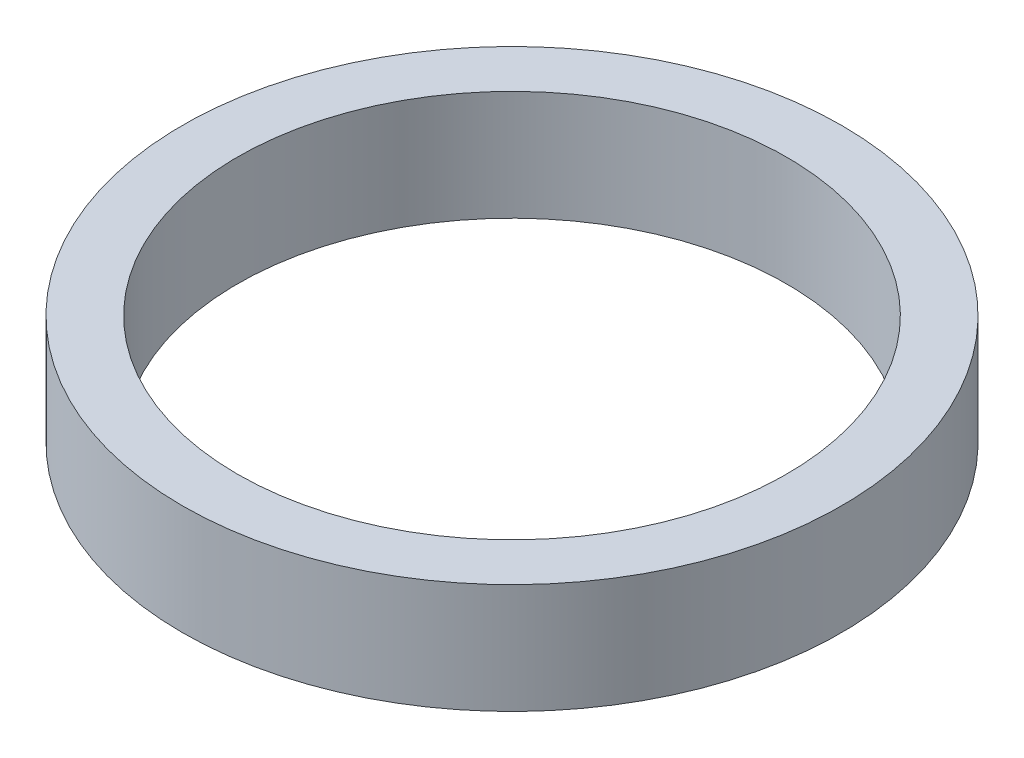
from build123d import *

# Parameters (mm, degrees)
SKETCH1_R           = 45
BOSS_EXTRUDE1_DEPTH = 15
SKETCH2_R           = 37.5
CUT_EXTRUDE1_DEPTH  = 66.383484153


with BuildPart() as part:
    # Sketch1 → Boss-Extrude1 (new body)
    with BuildSketch(Plane(origin=(0, 0, 0), x_dir=(1, 0, 0), z_dir=(0, 1, 0))):
        Circle(SKETCH1_R)
    extrude(amount=BOSS_EXTRUDE1_DEPTH)

    # Sketch2 → Cut-Extrude1 (cut, through all)
    with BuildSketch(Plane(origin=(0, 0, 0), x_dir=(1, 0, 0), z_dir=(0, 1, 0))):
        Circle(SKETCH2_R)
    extrude(amount=CUT_EXTRUDE1_DEPTH, mode=Mode.SUBTRACT)


solid = part.part
